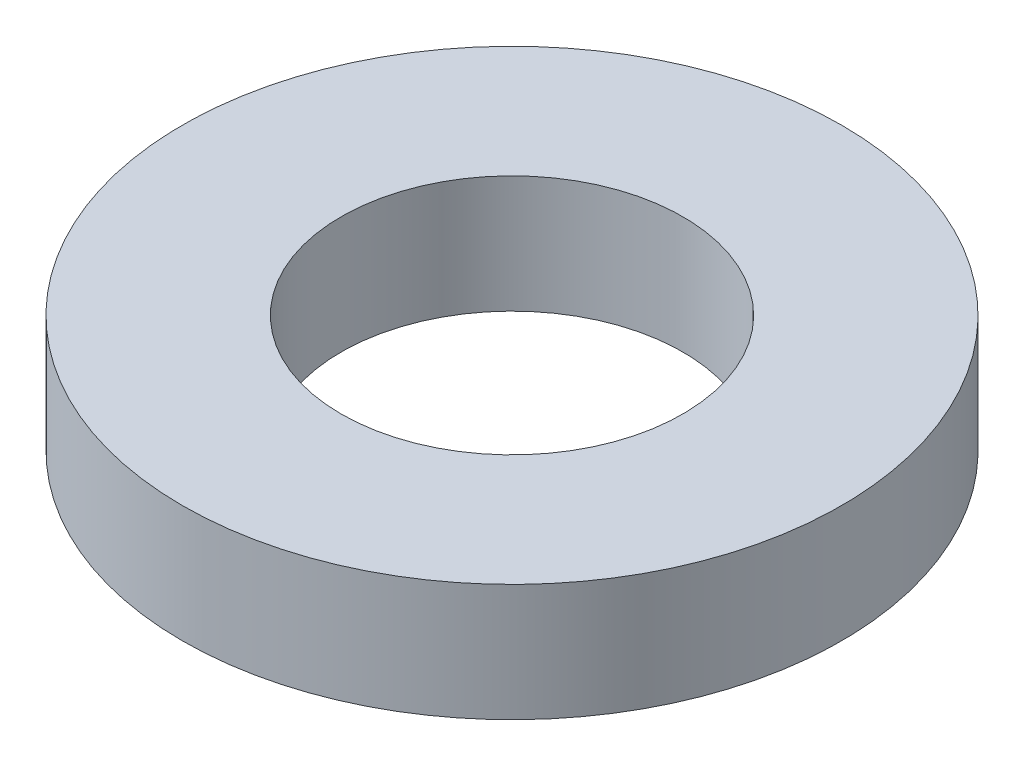
from build123d import *

# Parameters (mm, degrees)
SKETCH1_R           = 67.5
BOSS_EXTRUDE1_DEPTH = 24
SKETCH2_R           = 35
CUT_EXTRUDE1_DEPTH  = 99.430178299


with BuildPart() as part:
    # Sketch1 → Boss-Extrude1 (new body)
    with BuildSketch(Plane(origin=(0, 0, 0), x_dir=(1, 0, 0), z_dir=(0, 1, 0))):
        Circle(SKETCH1_R)
    extrude(amount=BOSS_EXTRUDE1_DEPTH)

    # Sketch2 → Cut-Extrude1 (cut, through all)
    with BuildSketch(Plane(origin=(0, 0, 0), x_dir=(1, 0, 0), z_dir=(0, 1, 0))):
        Circle(SKETCH2_R)
    extrude(amount=CUT_EXTRUDE1_DEPTH, mode=Mode.SUBTRACT)


solid = part.part
